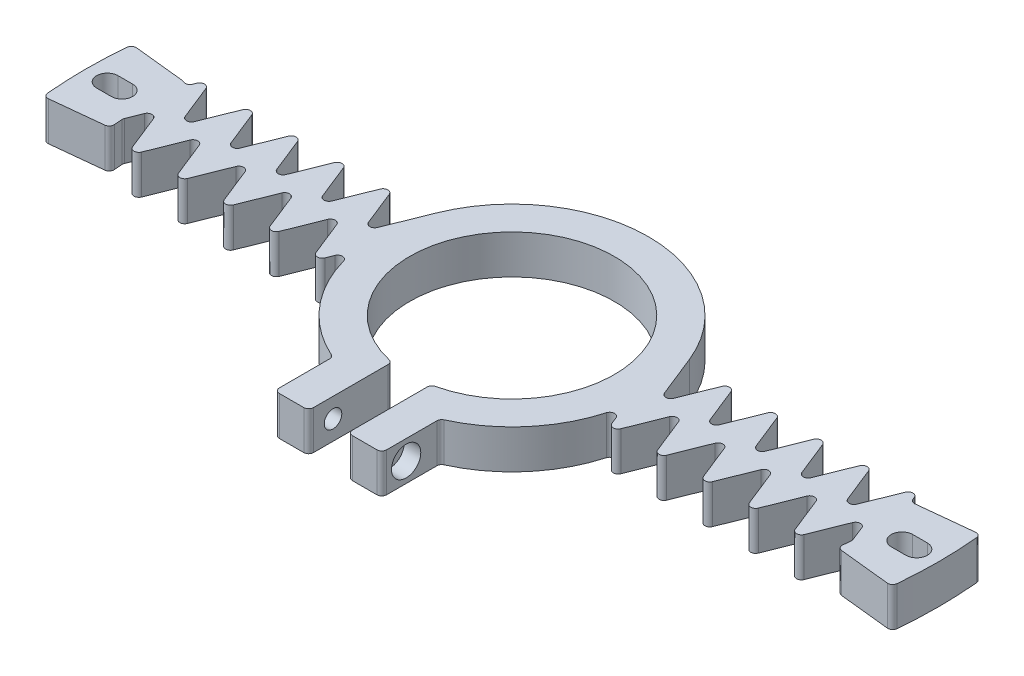
from build123d import *

# Parameters (mm, degrees)
EXTRUDE_1_DEPTH              = 8
CUT_EXTRUDE_1_DEPTH          = 96.61645391051708
HOLE_WIZARD_M3_1_D           = 3.6
HOLE_WIZARD_M3_1_CBORE_D     = 6
HOLE_WIZARD_M3_1_CBORE_DEPTH = 3.4
CUT_EXTRUDE_2_DEPTH          = 3
FILLET_1_R                   = 1
FILLET_2_R                   = 1
FILLET_3_R                   = 1
FILLET_4_R                   = 1


with BuildPart() as part:
    # 草图1 → 凸台-拉伸1 (new body)
    with BuildSketch(Plane(origin=(0, 0, 0), x_dir=(1, 0, 0), z_dir=(0, 1, 0))):
        with BuildLine():
            Line((-3.999999999999999, -20.615528128088304), (-3.999999999999999, -37.71281292110204))
            Line((-3.999999999999999, -37.71281292110204), (-11, -37.71281292110204))
            Line((-11, -37.71281292110204), (-10.999999999999998, -25.748786379167466))
            ThreePointArc((-10.999999999999998, -25.748786379167466), (-22.051728930852587, -17.25460086933915), (-27.638569712912915, -4.484357727083447))
            Line((-27.638569712912915, -4.484357727083447), (-30.350000000000012, -11.267952753684185))
            Line((-30.350000000000012, -11.267952753684185), (-35.050000000000004, 0.49074772881117895))
            Line((-35.050000000000004, 0.49074772881117895), (-39.75, -11.267952753684181))
            Line((-39.75, -11.267952753684181), (-44.449999999999996, 0.49074772881119005))
            Line((-44.449999999999996, 0.49074772881119005), (-49.150000000000006, -11.267952753684195))
            Line((-49.150000000000006, -11.267952753684195), (-53.85, 0.49074772881118345))
            Line((-53.85, 0.49074772881118345), (-58.55, -11.267952753684177))
            Line((-58.55, -11.267952753684177), (-63.25, 0.49074772881120704))
            Line((-63.25, 0.49074772881120704), (-67.95000000000002, -11.267952753684177))
            Line((-67.95000000000002, -11.267952753684177), (-72.65, 0.4907477288111795))
            Line((-72.65, 0.4907477288111795), (-74.83479502596157, -4.975284255428782))
            ThreePointArc((-74.83479502596157, -4.975284255428782), (-74.72569421838178, -6.408636639793499), (-74.58914215262055, -7.8396347450734805))
            Line((-74.58914215262055, -7.8396347450734805), (-87.02066584472396, -9.146240535919059))
            ThreePointArc((-87.02066584472396, -9.146240535919059), (-87.49999999999999, -1.072e-14), (-87.02066584472396, 9.146240535919079))
            Line((-87.02066584472396, 9.146240535919079), (-74.58914215262055, 7.839634745073499))
            ThreePointArc((-74.58914215262055, 7.839634745073499), (-74.68062135897526, 6.914101057792791), (-74.76061659690527, 5.987504158707094))
            Line((-74.76061659690527, 5.987504158707094), (-72.64999999999999, 11.267952753684217))
            Line((-72.64999999999999, 11.267952753684217), (-67.95, -0.4907477288111524))
            Line((-67.95, -0.4907477288111524), (-63.25, 11.267952753684211))
            Line((-63.25, 11.267952753684211), (-58.55, -0.490747728811178))
            Line((-58.55, -0.490747728811178), (-53.85, 11.267952753684185))
            Line((-53.85, 11.267952753684185), (-49.15, -0.49074772881119166))
            Line((-49.15, -0.49074772881119166), (-44.449999999999996, 11.267952753684186))
            Line((-44.449999999999996, 11.267952753684186), (-39.75, -0.49074772881117906))
            Line((-39.75, -0.49074772881117906), (-35.050000000000004, 11.267952753684186))
            Line((-35.050000000000004, 11.267952753684186), (-30.350000000000005, -0.49074772881119244))
            Line((-30.350000000000005, -0.49074772881119244), (-26.000000000000004, 10.392304845413278))
            ThreePointArc((-26.000000000000004, 10.392304845413278), (-4.5e-15, 28.000000000000007), (26.000000000000004, 10.392304845413278))
            Line((26.000000000000004, 10.392304845413278), (30.35000000000001, -0.4907477288111777))
            Line((30.35000000000001, -0.4907477288111777), (35.050000000000004, 11.267952753684186))
            Line((35.050000000000004, 11.267952753684186), (39.75, -0.4907477288111803))
            Line((39.75, -0.4907477288111803), (44.449999999999996, 11.267952753684188))
            Line((44.449999999999996, 11.267952753684188), (49.15, -0.49074772881119133))
            Line((49.15, -0.49074772881119133), (53.85, 11.267952753684185))
            Line((53.85, 11.267952753684185), (58.55, -0.4907477288111771))
            Line((58.55, -0.4907477288111771), (63.25, 11.267952753684211))
            Line((63.25, 11.267952753684211), (67.95, -0.4907477288111524))
            Line((67.95, -0.4907477288111524), (72.64999999999999, 11.267952753684217))
            Line((72.64999999999999, 11.267952753684217), (74.76061659690527, 5.987504158707094))
            ThreePointArc((74.76061659690527, 5.987504158707094), (74.68062135897526, 6.9141010577927915), (74.58914215262055, 7.839634745073499))
            Line((74.58914215262055, 7.839634745073499), (87.02066584472396, 9.146240535919079))
            ThreePointArc((87.02066584472396, 9.146240535919079), (87.49999999999999, 9.71e-15), (87.02066584472396, -9.146240535919059))
            Line((87.02066584472396, -9.146240535919059), (74.58914215262055, -7.8396347450734805))
            ThreePointArc((74.58914215262055, -7.8396347450734805), (74.72569421838178, -6.408636639793495), (74.83479502596157, -4.975284255428782))
            Line((74.83479502596157, -4.975284255428782), (72.64999999999999, 0.4907477288111611))
            Line((72.64999999999999, 0.4907477288111611), (67.95, -11.267952753684195))
            Line((67.95, -11.267952753684195), (63.25, 0.49074772881118905))
            Line((63.25, 0.49074772881118905), (58.55, -11.267952753684186))
            Line((58.55, -11.267952753684186), (53.85, 0.4907477288111754))
            Line((53.85, 0.4907477288111754), (49.15, -11.267952753684195))
            Line((49.15, -11.267952753684195), (44.449999999999996, 0.49074772881118905))
            Line((44.449999999999996, 0.49074772881118905), (39.75, -11.267952753684181))
            Line((39.75, -11.267952753684181), (35.050000000000004, 0.4907477288111768))
            Line((35.050000000000004, 0.4907477288111768), (30.350000000000012, -11.267952753684185))
            Line((30.350000000000012, -11.267952753684185), (27.638569712912915, -4.484357727083447))
            ThreePointArc((27.638569712912915, -4.484357727083447), (22.05172893085258, -17.25460086933915), (10.999999999999998, -25.748786379167466))
            Line((10.999999999999998, -25.748786379167466), (11, -37.71281292110204))
            Line((11, -37.71281292110204), (3.999999999999999, -37.71281292110204))
            Line((3.999999999999999, -37.71281292110204), (3.999999999999999, -20.615528128088304))
            ThreePointArc((3.999999999999999, -20.615528128088304), (1.29e-15, 21), (-3.999999999999999, -20.615528128088304))
        make_face()
    extrude(amount=EXTRUDE_1_DEPTH)

    # 草图2 → 切除-拉伸1 (cut, through all)
    with BuildSketch(Plane(origin=(0, 8, 0), x_dir=(1, 0, 0), z_dir=(0, 1, 0))):
        with BuildLine():
            Line((-83, -2.2), (-80, -2.2))
            ThreePointArc((-80, -2.2), (-77.8, 5.5e-16), (-80, 2.2))
            Line((-80, 2.2), (-83, 2.2))
            ThreePointArc((-83, 2.2), (-85.2, -2.7e-16), (-83, -2.2))
        make_face()
        with BuildLine():
            Line((83, 2.2), (80, 2.2))
            ThreePointArc((80, 2.2), (77.8, 2.8e-16), (80, -2.2))
            Line((80, -2.2), (83, -2.2))
            ThreePointArc((83, -2.2), (85.2, 0), (83, 2.2))
        make_face()
    extrude(amount=-CUT_EXTRUDE_1_DEPTH, mode=Mode.SUBTRACT)

    # M3 六角圆柱头螺钉的柱形沉头孔1 (through all)
    with Locations(Plane(origin=(10.999999999999995, 0, -1.59e-15), x_dir=(-1.4e-16, 0, -1), z_dir=(1, 0, -1.4e-16))):
        with Locations((-32.712812921, 4)):
            CounterBoreHole(HOLE_WIZARD_M3_1_D / 2, HOLE_WIZARD_M3_1_CBORE_D / 2, HOLE_WIZARD_M3_1_CBORE_DEPTH)

    # 草图7 → 切除-拉伸2 (cut)
    with BuildSketch(Plane.ZY.offset(10.999999999999995)):
        Polygon((34.44486372867093, 1), (36.1769145362398, 3.9999999999999853), (34.44486372867092, 6.999999999999999), (30.98076211353316, 6.999999999999999), (29.248711305964285, 4.0000000000000036), (30.980762113533164, 1), align=None)
    extrude(amount=-CUT_EXTRUDE_2_DEPTH, mode=Mode.SUBTRACT)

    # 圆角1
    fillet_1_edges = [part.edges().sort_by_distance(p)[0] for p in [
        (-87.02066584472396, 4, 9.146240535919059),
        (-74.58914215262055, 4, -7.839634745073498),
        (-72.64999999999999, 4, -11.267952753684217),
        (-67.95, 4, 0.4907477288111524),
        (-63.25, 4, -11.267952753684211),
        (-58.55, 4, 0.490747728811178),
        (-53.85, 4, -11.267952753684185),
        (-49.15, 4, 0.49074772881119166),
        (-44.449999999999996, 4, -11.267952753684186),
        (-39.75, 4, 0.49074772881117906),
        (-35.050000000000004, 4, -11.267952753684186),
        (-30.350000000000005, 4, 0.49074772881119244),
        (30.35000000000001, 4, 0.4907477288111777),
        (30.350000000000012, 4, 11.267952753684185),
    ]]
    fillet(fillet_1_edges, radius=FILLET_1_R)

    # 圆角2
    fillet_2_edges = [part.edges().sort_by_distance(p)[0] for p in [
        (-74.76061659690527, 4, -5.987504158707093),
        (-44.449999999999996, 4, -0.49074772881119005),
        (-49.150000000000006, 4, 11.267952753684195),
        (-53.85, 4, -0.49074772881118345),
        (-58.55, 4, 11.267952753684177),
        (-63.25, 4, -0.49074772881120704),
        (-67.95000000000002, 4, 11.267952753684177),
        (-72.65, 4, -0.4907477288111795),
        (-74.83479502596157, 4, 4.975284255428782),
        (35.050000000000004, 4, -11.267952753684186),
        (39.75, 4, 0.4907477288111803),
        (44.449999999999996, 4, -11.267952753684188),
        (49.15, 4, 0.49074772881119133),
        (53.85, 4, -11.267952753684185),
        (58.55, 4, 0.4907477288111771),
        (63.25, 4, -11.267952753684211),
        (67.95, 4, 0.4907477288111524),
        (-87.02066584472396, 4, -9.14624053591908),
        (-74.58914215262055, 4, 7.8396347450734805),
    ]]
    fillet(fillet_2_edges, radius=FILLET_2_R)

    # 圆角3
    # the kernel refuses this fillet: 1 mm, written as the material it adds along each edge
    with BuildSketch(Plane(origin=(74.76061659690527, 0, -5.987504158707094), x_dir=(-0.3711537444790472, 0, -0.9285714285714277), z_dir=(0, 1, 0))) as fillet_3_piece_1:
        with BuildLine():
            CenterArc((2.6651839525742878, -1.0000000000000027), FILLET_3_R, 89.99999999999993, 61.84872864155456)
            ThreePointArc((1.7834789265618267, -0.5281989327011192), (0.8901019383920806, -0.2696286163547397), (0, 0))
            Line((0, 0), (2.665183952574289, -9e-17))
        make_face()
    extrude(amount=8)
    with BuildSketch(Plane(origin=(74.83479502596157, 0, 4.975284255428782), x_dir=(-0.0678632961762223, 0, 0.997694629148668), z_dir=(0, 1, 0))) as fillet_3_piece_2:
        with BuildLine():
            CenterArc((0.22791333828003948, -0.9999988301310755), FILLET_3_R, 89.91235921161058, 25.765701275617644)
            Line((-0.20540067705303292, -0.09875581955294786), (0, 0))
            ThreePointArc((0, 0), (0.11472147899999659, 8.774016962278e-05), (0.22944295799999334, 0))
        make_face()
    extrude(amount=8)
    with BuildSketch(Plane(origin=(72.64999999999999, 0, -0.4907477288111611), x_dir=(0.37115374447904725, 0, 0.9285714285714277), z_dir=(0, 1, 0))) as fillet_3_piece_3:
        with BuildLine():
            CenterArc((FILLET_3_R * 2.50185116649, -FILLET_3_R), FILLET_3_R, 89.9999999999999, 136.42642140347658)
            Line((FILLET_3_R * 1.81256564103, -FILLET_3_R * 1.72448979592), (0, 0))
            Line((0, 0), (FILLET_3_R * 2.50185116649, 0))
        make_face()
    extrude(amount=8)
    # the kernel refuses this fillet: 1 mm, written as the material it takes off along each edge
    with BuildSketch(Plane(origin=(72.64999999999999, -6.2546279162209135, -11.267952753684217), x_dir=(-0.3711537444790427, 0, 0.9285714285714295), z_dir=(0, 1, 0))) as fillet_3_2_piece_1:
        with BuildLine():
            CenterArc((FILLET_3_R * 2.50185116649, FILLET_3_R), FILLET_3_R, 133.57357859652382, 136.42642140347607)
            Line((FILLET_3_R * 1.81256564103, FILLET_3_R * 1.72448979592), (0, 0))
            Line((0, 0), (FILLET_3_R * 2.50185116649, -1e-17))
        make_face()
    extrude(amount=20.509255832441827, mode=Mode.SUBTRACT)
    with BuildSketch(Plane(origin=(87.02066584472396, -2.5289439849245667, -9.14624053591908), x_dir=(-0.994521895368274, 0, 0.10452846326764915), z_dir=(0, 1, 0))) as fillet_3_2_piece_2:
        with BuildLine():
            CenterArc((1.0057805399690254, 1), FILLET_3_R, 179.33760629075303, 90.66239370924654)
            ThreePointArc((0.00584736702069528, 1.0115606936416168), (0.00146185396670163, 0.5057887969849134), (0, 0))
            Line((0, 0), (1.0057805399690174, -1e-17))
        make_face()
    extrude(amount=13.057887969849133, mode=Mode.SUBTRACT)
    with BuildSketch(Plane(origin=(87.02066584472396, -2.5289439849245667, 9.146240535919063), x_dir=(0.09877793940042534, 0, -0.9951095008529492), z_dir=(0, 1, 0))) as fillet_3_2_piece_3:
        with BuildLine():
            CenterArc((1.0057971505757124, 0.9999832930975181), FILLET_3_R, 179.66880314537613, 90.66239370924745)
            Line((0.00581385747818958, 1.0057637364916374), (0, 0))
            ThreePointArc((0, 0), (0.5057887969849048, -0.00146185396668422), (1.0115775939698266, 0))
        make_face()
    extrude(amount=13.057887969849133, mode=Mode.SUBTRACT)
    with BuildSketch(Plane(origin=(74.58914215262055, -2.4835519196333244, 7.8396347450734805), x_dir=(0.9945218953682741, 0, 0.10452846326764609), z_dir=(0, 1, 0))) as fillet_3_2_piece_4:
        with BuildLine():
            CenterArc((0.9934207678533251, 0.9999999999999998), FILLET_3_R, 180.75391359096687, 89.24608640903341)
            ThreePointArc((-0.00649266330263438, 0.9868421052631542), (-0.00162318339048998, 0.4934317317007946), (0, 0))
            Line((0, 0), (0.9934207678533298, 0))
        make_face()
    extrude(amount=12.967103839266649, mode=Mode.SUBTRACT)

    # 圆角4
    fillet_4_edges = [part.edges().sort_by_distance(p)[0] for p in [
        (74.58914215262055, 4, -7.8396347450735),
        (27.63856971291291, 4, 4.484357727083447),
        (10.999999999999996, 4, 25.748786379167463),
        (3.999999999999999, 4, 20.615528128088304),
        (3.999999999999999, 4, 37.71281292110204),
        (11, 4, 37.71281292110204),
        (-4.000000000000002, 4, 20.615528128088304),
        (67.95, 4, 11.267952753684195),
        (63.25, 4, -0.49074772881118905),
        (58.55, 4, 11.267952753684186),
        (53.85, 4, -0.4907477288111754),
        (49.15, 4, 11.267952753684195),
        (44.449999999999996, 4, -0.49074772881118905),
        (39.75, 4, 11.267952753684181),
        (35.050000000000004, 4, -0.4907477288111768),
        (-11, 4, 25.74878637916747),
        (-11, 4, 37.71281292110204),
        (-3.999999999999999, 4, 37.71281292110204),
        (-27.63856971291292, 4, 4.48435772708345),
        (-30.350000000000012, 4, 11.267952753684185),
        (-35.050000000000004, 4, -0.49074772881117895),
        (-39.75, 4, 11.267952753684181),
    ]]
    fillet(fillet_4_edges, radius=FILLET_4_R)


solid = part.part
